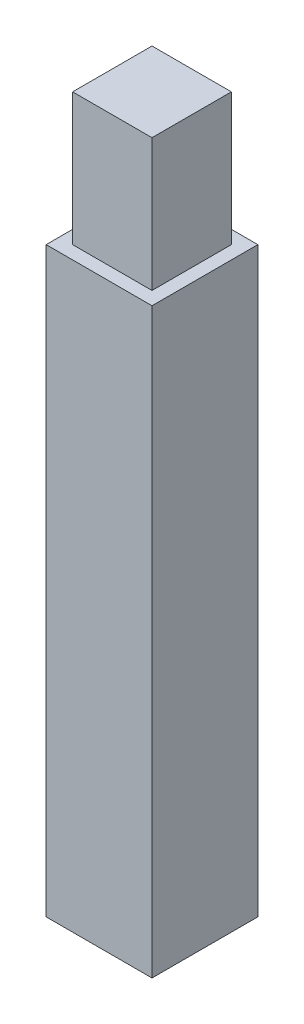
from build123d import *

# Parameters (mm, degrees)
SKETCH1_W           = 4
SKETCH1_H           = 4
BOSS_EXTRUDE1_DEPTH = 22
SKETCH2_W           = 3
SKETCH2_H           = 3
BOSS_EXTRUDE2_DEPTH = 5


with BuildPart() as part:
    # Sketch1 → Boss-Extrude1 (new body)
    with BuildSketch(Plane(origin=(0, 0, 0), x_dir=(1, 0, 0), z_dir=(0, 1, 0))):
        with Locations((2, 2)):
            Rectangle(SKETCH1_W, SKETCH1_H)
    extrude(amount=BOSS_EXTRUDE1_DEPTH)

    # Sketch2 → Boss-Extrude2 (add)
    with BuildSketch(Plane(origin=(0, 22, 0), x_dir=(1, 0, 0), z_dir=(0, 1, 0))):
        with Locations((2, 2)):
            Rectangle(SKETCH2_W, SKETCH2_H)
    extrude(amount=BOSS_EXTRUDE2_DEPTH)


solid = part.part
